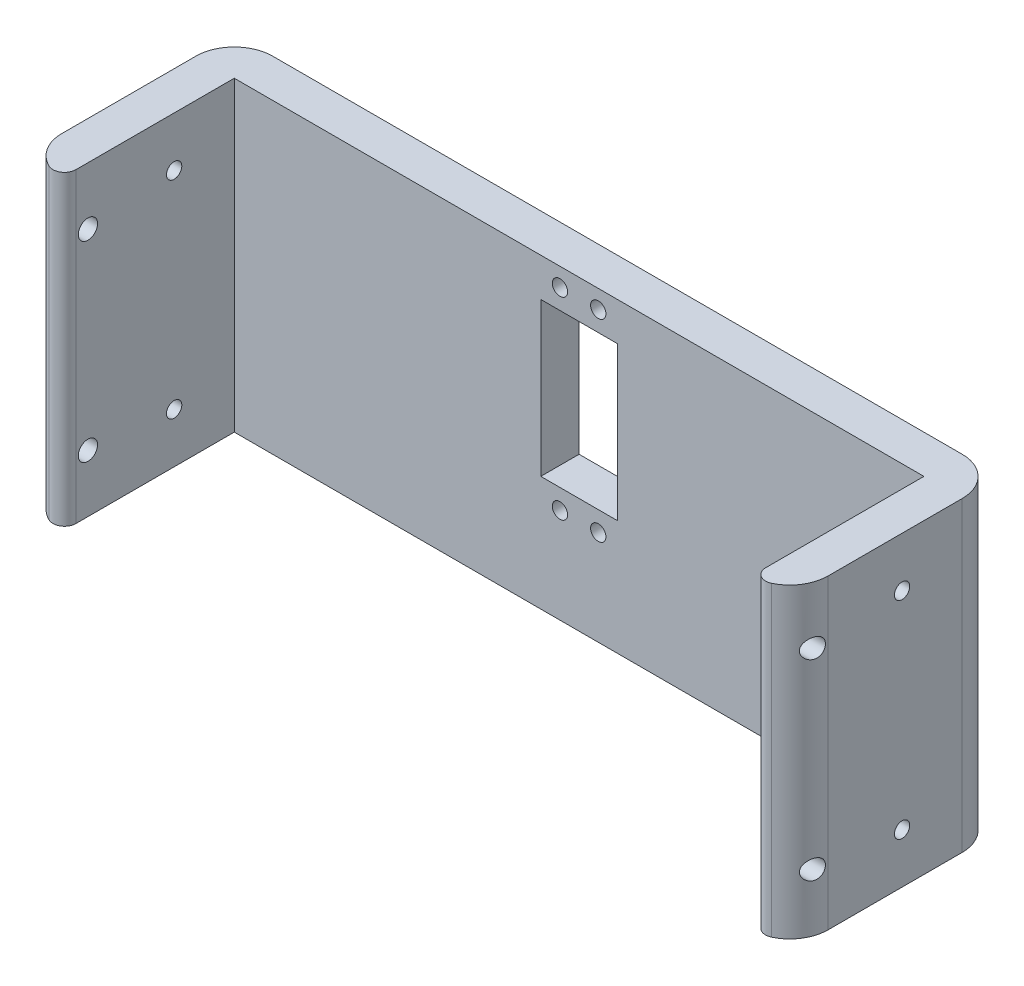
from build123d import *

# Parameters (mm, degrees)
ESQUISSE1_W             = 200
ESQUISSE1_H             = 80
BOSS_EXTRU_1_DEPTH      = 10
ESQUISSE2_W             = 10
ESQUISSE2_H             = 80
BOSS_EXTRU_2_DEPTH      = 50
ESQUISSE8_R             = 2
ENL_V_MAT_EXTRU_3_DEPTH = 213.602916255
ESQUISSE9_W             = 10
ESQUISSE9_H             = 80
ENL_V_MAT_EXTRU_4_DEPTH = 5
ESQUISSE10_R            = 2.515
ENL_V_MAT_EXTRU_5_DEPTH = 202.804360706
ENL_V_START             = -5
ESQUISSE11_R            = 2.515
ENL_V_MAT_EXTRU_6_DEPTH = 5
CONG_1_R                = 10
CONG_2_START            = -41
CONG_2_DEPTH            = 82
CONG_3_R                = 3
ESQUISSE12_W            = 20
ESQUISSE12_H            = 40
ENL_V_MAT_EXTRU_7_DEPTH = 121.628178046
ESQUISSE13_R            = 2
ENL_V_MAT_EXTRU_8_DEPTH = 117.467447093
ESQUISSE14_R            = 2
ENL_V_MAT_EXTRU_9_DEPTH = 212.071450838


with BuildPart() as part:
    # Esquisse1 → Boss.-Extru.1 (new body)
    with BuildSketch(Plane.XY):
        Rectangle(ESQUISSE1_W, ESQUISSE1_H)
    extrude(amount=BOSS_EXTRU_1_DEPTH)

    # Esquisse2 → Boss.-Extru.2 (add)
    with BuildSketch(Plane.XY.offset(10)):
        with Locations((-95, 0)):
            Rectangle(ESQUISSE2_W, ESQUISSE2_H)
        with Locations((95, 0)):
            Rectangle(ESQUISSE2_W, ESQUISSE2_H)
    extrude(amount=BOSS_EXTRU_2_DEPTH)

    # Esquisse8 → Enlèv. mat.-Extru.3 (cut, through all)
    with BuildSketch(Plane(origin=(100, 0, 0), x_dir=(0, 0, -1), z_dir=(1, 0, 0))):
        with Locations(Location((-25.7, 27, 0), (0, 0, 90))):
            Circle(ESQUISSE8_R)
    extrude(amount=-ENL_V_MAT_EXTRU_3_DEPTH, mode=Mode.SUBTRACT)

    # Esquisse9 → Enlèv. mat.-Extru.4 (cut)
    with BuildSketch(Plane.XY.offset(60)):
        with Locations((-95, 0)):
            Rectangle(ESQUISSE9_W, ESQUISSE9_H)
        with Locations((95, 0)):
            Rectangle(ESQUISSE9_W, ESQUISSE9_H)
    extrude(amount=-ENL_V_MAT_EXTRU_4_DEPTH, mode=Mode.SUBTRACT)

    # Esquisse10 → Enlèv. mat.-Extru.5 (cut, through all)
    with BuildSketch(Plane.ZY.offset(-90)):
        with Locations(Location((48.2, 25, 0), (0, 0, 270))):
            Circle(ESQUISSE10_R)
        with Locations(Location((48.2, -25, 0), (0, 0, 270))):
            Circle(ESQUISSE10_R)
    extrude(amount=-ENL_V_MAT_EXTRU_5_DEPTH, mode=Mode.SUBTRACT)

    # Esquisse11 → Enlèv. mat.-Extru.6 (cut)
    with BuildSketch(Plane.ZY.offset(100).offset(ENL_V_START)):
        with Locations(Location((48.2, 25, 0), (0, 0, 270))):
            Circle(ESQUISSE11_R)
        with Locations(Location((48.2, -25, 0), (0, 0, 270))):
            Circle(ESQUISSE11_R)
    extrude(amount=-ENL_V_MAT_EXTRU_6_DEPTH, mode=Mode.SUBTRACT)

    # Congé1
    cong_1_edges = [part.edges().sort_by_distance(p)[0] for p in [
        (-100, 0, 0),
        (100, 0, 0),
    ]]
    fillet(cong_1_edges, radius=CONG_1_R)

    # Congé2: read off the stored shape, not the designer's step
    # Congé2 outline → Congé2 (cut)
    with BuildSketch(Plane(origin=(0, 0, 0), x_dir=(1, 0, 0), z_dir=(0, 1, 0)).offset(CONG_2_START)):
        with BuildLine():
            Line((100, -55), (100, -45))
            ThreePointArc((100, -45), (97.071067812, -52.071067812), (90, -55))
            Line((90, -55), (100, -55))
        make_face()
        with BuildLine():
            ThreePointArc((-90, -55), (-97.071067812, -52.071067812), (-100, -45))
            Line((-100, -45), (-100, -55))
            Line((-100, -55), (-90, -55))
        make_face()
    extrude(amount=CONG_2_DEPTH, mode=Mode.SUBTRACT)

    # Congé3
    cong_3_edges = [part.edges().sort_by_distance(p)[0] for p in [
        (-90, 0, 55),
        (90, 0, 55),
    ]]
    fillet(cong_3_edges, radius=CONG_3_R)

    # Esquisse12 → Enlèv. mat.-Extru.7 (cut, through all)
    with BuildSketch(Plane(origin=(0, 0, 0), x_dir=(-1, 0, 0), z_dir=(0, 0, -1))):
        with Locations((0, 10)):
            Rectangle(ESQUISSE12_W, ESQUISSE12_H)
    extrude(amount=-ENL_V_MAT_EXTRU_7_DEPTH, mode=Mode.SUBTRACT)

    # Esquisse13 → Enlèv. mat.-Extru.8 (cut, through all)
    with BuildSketch(Plane.XY.offset(10)):
        with Locations((-5, 35.2)):
            Circle(ESQUISSE13_R)
        with Locations((5, 35.2)):
            Circle(ESQUISSE13_R)
        with Locations((-5, -15.2)):
            Circle(ESQUISSE13_R)
        with Locations((5, -15.2)):
            Circle(ESQUISSE13_R)
    extrude(amount=-ENL_V_MAT_EXTRU_8_DEPTH, mode=Mode.SUBTRACT)

    # Esquisse14 → Enlèv. mat.-Extru.9 (cut, through all)
    with BuildSketch(Plane.ZY.offset(100)):
        with Locations(Location((25.7, 27, 0), (0, 0, 90))):
            Circle(ESQUISSE14_R)
        with Locations(Location((25.7, -27, 0), (0, 0, 270))):
            Circle(ESQUISSE14_R)
    extrude(amount=-ENL_V_MAT_EXTRU_9_DEPTH, mode=Mode.SUBTRACT)


solid = part.part
